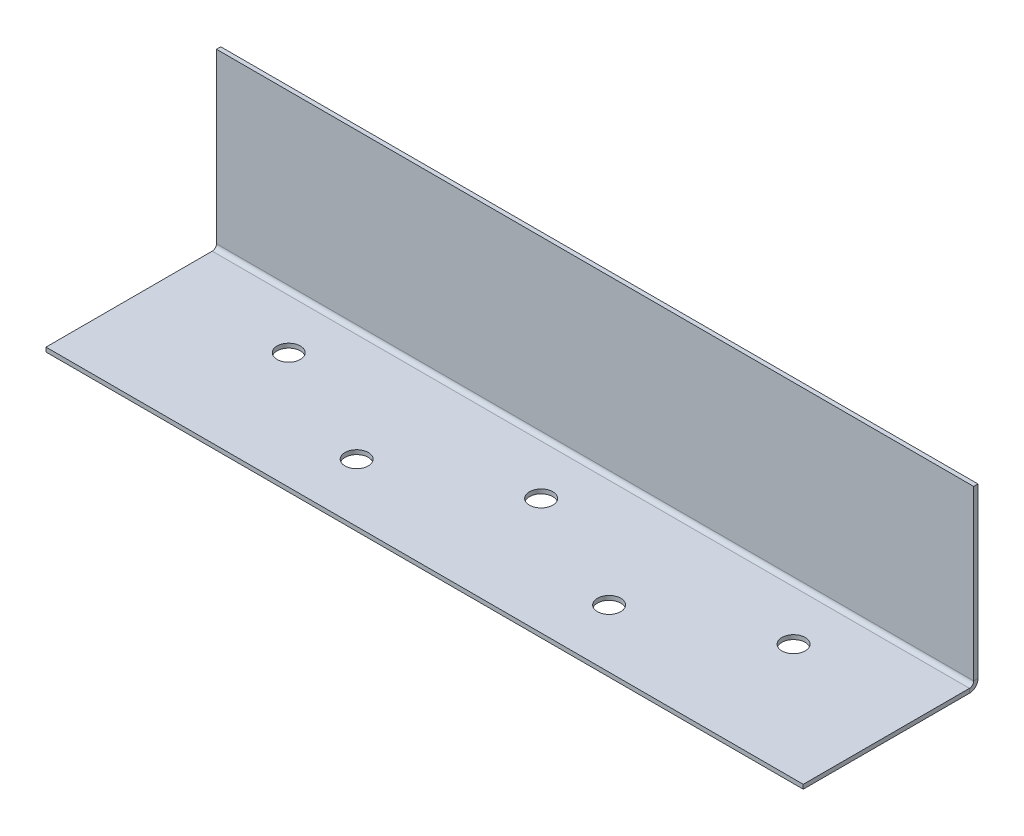
from build123d import *

# Parameters (mm, degrees)
SKETCH1_W                    = 130
SKETCH1_H                    = 30
SKETCH1_R                    = 2
BASE_FLANGE1_DEPTH           = 0.7366
EDGE_FLANGE1_STRIP_W         = 4.4196
EDGE_FLANGE1_STRIP_H         = 0.7366
EDGE_FLANGE1_STRIP_CUT_DEPTH = 130
EDGE_FLANGE1_DEPTH           = 130


# Sheet-metal steps are written as plain solids
with BuildPart() as part:
    # Sketch1 → Base-Flange1 (new body)
    with BuildSketch(Plane(origin=(0, 0, 0), x_dir=(1, 0, 0), z_dir=(0, 1, 0))):
        Rectangle(SKETCH1_W, SKETCH1_H)
        with Locations(Location((0, 5, 0), (0, 0, 270))):
            Circle(SKETCH1_R, mode=Mode.SUBTRACT)
        with Locations(Location((-21.666666667, -5, 0), (0, 0, 270))):
            Circle(SKETCH1_R, mode=Mode.SUBTRACT)
        with Locations(Location((-43.333333333, 5, 0), (0, 0, 270))):
            Circle(SKETCH1_R, mode=Mode.SUBTRACT)
        with Locations(Location((21.666666667, -5, 0), (0, 0, 270))):
            Circle(SKETCH1_R, mode=Mode.SUBTRACT)
        with Locations(Location((43.333333333, 5, 0), (0, 0, 270))):
            Circle(SKETCH1_R, mode=Mode.SUBTRACT)
    extrude(amount=-BASE_FLANGE1_DEPTH)

    # Edge-Flange1 strip (across the edge) → Edge-Flange1 strip cut (cut)
    with BuildSketch(Plane(origin=(65, 0, -15), x_dir=(0, 0, 1), z_dir=(-1, 0, 0))):
        with Locations((-0.7366, -0.3683)):
            Rectangle(EDGE_FLANGE1_STRIP_W, EDGE_FLANGE1_STRIP_H)
    extrude(amount=EDGE_FLANGE1_STRIP_CUT_DEPTH, mode=Mode.SUBTRACT)

    # Edge-Flange1 section (across the edge) → Edge-Flange1 (add)
    with BuildSketch(Plane(origin=(65, 0, -15), x_dir=(0, 0, 1), z_dir=(-1, 0, 0))):
        with BuildLine():
            Line((0, 0.7366), (0, 29.6534))
            Line((0, 29.6534), (0.7366, 29.6534))
            Line((0.7366, 29.6534), (0.7366, 0.7366))
            ThreePointArc((0.7366, 0.7366), (0.952345145, 0.215745145), (1.4732, 0))
            Line((1.4732, 0), (1.4732, -0.7366))
            ThreePointArc((1.4732, -0.7366), (0.43149029, -0.30510971), (0, 0.7366))
        make_face()
    extrude(amount=EDGE_FLANGE1_DEPTH)


solid = part.part
